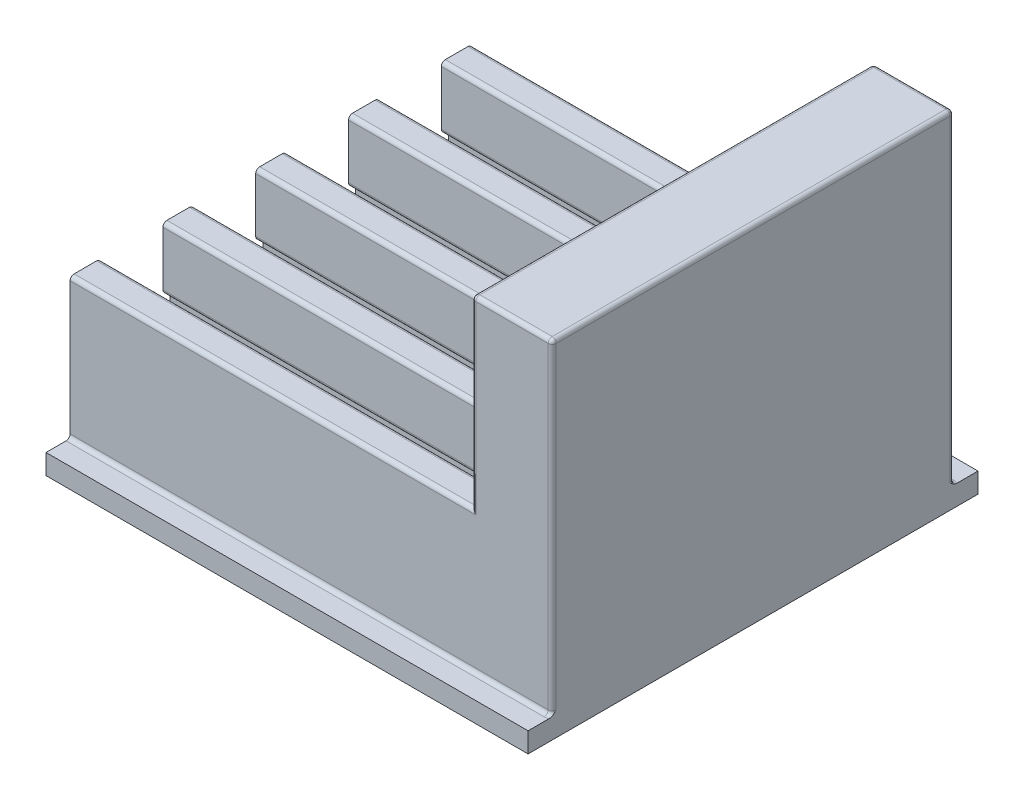
from build123d import *

# Parameters (mm, degrees)
SKETCH1_W           = 120
SKETCH1_H           = 100
BOSS_EXTRUDE1_DEPTH = 81
SKETCH2_W           = 100
SKETCH2_H           = 100
CUT_EXTRUDE1_DEPTH  = 46
SKETCH6_W           = 15.5
SKETCH6_H           = 15.5
CUT_EXTRUDE4_DEPTH  = 100
SKETCH8_W           = 19.1
SKETCH8_H           = 10
CUT_EXTRUDE5_DEPTH  = 100
SKETCH6_3_R         = 5.95
CUT_EXTRUDE6_DEPTH  = 111
FILLET1_R           = 1
CHAMFER1_SIZE       = 1
FILLET2_R           = 1
FILLET3_R           = 1
SKETCH9_W           = 120
SKETCH9_H           = 112
BOSS_EXTRUDE2_DEPTH = 5
FILLET4_R           = 1


with BuildPart() as part:
    # Sketch1 → Boss-Extrude1 (new body)
    with BuildSketch(Plane(origin=(0, 0, 0), x_dir=(1, 0, 0), z_dir=(0, 1, 0))):
        with Locations((-3.53539823, -7.581858407)):
            Rectangle(SKETCH1_W, SKETCH1_H)
    extrude(amount=BOSS_EXTRUDE1_DEPTH)

    # Sketch2 → Cut-Extrude1 (cut)
    with BuildSketch(Plane(origin=(0, 81, 0), x_dir=(1, 0, 0), z_dir=(0, 1, 0))):
        with Locations((-13.53539823, -7.581858407)):
            Rectangle(SKETCH2_W, SKETCH2_H)
    extrude(amount=-CUT_EXTRUDE1_DEPTH, mode=Mode.SUBTRACT)

    # Sketch6 → Cut-Extrude4 (cut)
    with BuildSketch(Plane.ZY.offset(63.53539823)):
        with Locations((-27.068141593, 27.25)):
            Rectangle(SKETCH6_W, SKETCH6_H)
        with Locations((-3.968141593, 27.25)):
            Rectangle(SKETCH6_W, SKETCH6_H)
        with Locations((19.131858407, 27.25)):
            Rectangle(SKETCH6_W, SKETCH6_H)
        with Locations((42.231858407, 27.25)):
            Rectangle(SKETCH6_W, SKETCH6_H)
    extrude(amount=-CUT_EXTRUDE4_DEPTH, mode=Mode.SUBTRACT)

    # Sketch8 → Cut-Extrude5 (cut)
    with BuildSketch(Plane.ZY.offset(63.53539823)):
        with Locations((-27.068141593, 14.5)):
            Rectangle(SKETCH8_W, SKETCH8_H)
        with Locations((-3.968141593, 14.5)):
            Rectangle(SKETCH8_W, SKETCH8_H)
        with Locations((42.231858407, 14.5)):
            Rectangle(SKETCH8_W, SKETCH8_H)
        with Locations((19.131858407, 14.5)):
            Rectangle(SKETCH8_W, SKETCH8_H)
    extrude(amount=-CUT_EXTRUDE5_DEPTH, mode=Mode.SUBTRACT)

    # Sketch6<3> → Cut-Extrude6 (cut)
    with BuildSketch(Plane.ZY.offset(63.53539823)):
        with Locations((-27.068141593, 27.25)):
            Circle(SKETCH6_3_R)
        with Locations((-3.968141593, 27.25)):
            Circle(SKETCH6_3_R)
        with Locations((42.231858407, 27.25)):
            Circle(SKETCH6_3_R)
        with Locations((19.131858407, 27.25)):
            Circle(SKETCH6_3_R)
    extrude(amount=-CUT_EXTRUDE6_DEPTH, mode=Mode.SUBTRACT)

    # Fillet1
    fillet1_edges = [part.edges().sort_by_distance(p)[0] for p in [
        (56.46460177, 81, 7.581858407),
        (46.46460177, 81, 57.581858407),
        (46.46460177, 81, -42.418141593),
        (-13.53539823, 35, -42.418141593),
        (36.46460177, 58, -42.418141593),
        (-13.53539823, 35, 57.581858407),
        (36.46460177, 58, 57.581858407),
        (36.46460177, 81, 7.581858407),
        (56.46460177, 40.5, -42.418141593),
        (56.46460177, 40.5, 57.581858407),
    ]]
    fillet(fillet1_edges, radius=FILLET1_R)

    # Chamfer1
    chamfer1_edges = [part.edges().sort_by_distance(p)[0] for p in [
        (36.46460177, 27.25, -33.018141593),
        (36.46460177, 27.25, -9.918141593),
        (36.46460177, 27.25, 13.181858407),
        (36.46460177, 27.25, 36.281858407),
    ]]
    chamfer(chamfer1_edges, length=CHAMFER1_SIZE)

    # Fillet2
    fillet2_edges = [part.edges().sort_by_distance(p)[0] for p in [
        (47.46460177, 27.25, -33.018141593),
        (47.46460177, 27.25, -9.918141593),
        (47.46460177, 27.25, 13.181858407),
        (47.46460177, 27.25, 36.281858407),
    ]]
    fillet(fillet2_edges, radius=FILLET2_R)

    # Fillet3
    fillet3_edges = [part.edges().sort_by_distance(p)[0] for p in [
        (-13.53539823, 19.5, -19.318141593),
        (-13.53539823, 19.5, -34.818141593),
        (-13.53539823, 35, -34.818141593),
        (-13.53539823, 35, -19.318141593),
        (-13.53539823, 19.5, 3.781858407),
        (-13.53539823, 19.5, -11.718141593),
        (-13.53539823, 35, -11.718141593),
        (-13.53539823, 35, 3.781858407),
        (-13.53539823, 19.5, 49.981858407),
        (-13.53539823, 19.5, 34.481858407),
        (-13.53539823, 35, 34.481858407),
        (-13.53539823, 35, 49.981858407),
        (-13.53539823, 19.5, 26.881858407),
        (-13.53539823, 19.5, 11.381858407),
        (-13.53539823, 35, 11.381858407),
        (-13.53539823, 35, 26.881858407),
    ]]
    fillet(fillet3_edges, radius=FILLET3_R)

    # Sketch9 → Boss-Extrude2 (add)
    with BuildSketch(Plane.XZ):
        with Locations((-3.53539823, 7.581858407)):
            Rectangle(SKETCH9_W, SKETCH9_H)
    extrude(amount=BOSS_EXTRUDE2_DEPTH)

    # Fillet4
    # the kernel refuses this fillet: 1 mm, written as the material it adds along each edge
    with BuildSketch(Plane(origin=(-63.53539823, 0, -42.418141593), x_dir=(0, 0, -1), z_dir=(1, 0, 0)), Plane(origin=(55.46460177, 0, 57.581858407), x_dir=(0, 0, 1), z_dir=(-1, 0, 0))) as fillet4_piece_1:
        with BuildLine():
            CenterArc((FILLET4_R, FILLET4_R), FILLET4_R, 180, 90)
            Line((0, FILLET4_R), (0, 0))
            Line((0, 0), (FILLET4_R, 0))
        make_face()
    extrude(amount=119)
    with BuildSketch(Plane(origin=(55.46460177, 0, -41.418141593), x_dir=(0, 0, -1), z_dir=(-1, 0, 0))) as fillet4_piece_2_section:
        with BuildLine():
            CenterArc((1 + FILLET4_R, -FILLET4_R), FILLET4_R, 90, 90)
            Line((1, -FILLET4_R), (1, 0))
            Line((1, 0), (1 + FILLET4_R, 0))
        make_face()
    fillet4_piece_2 = revolve(axis=Axis((55.46460177, 0, -41.418141593), (0, -1, 0)), revolution_arc=233.296989237, mode=Mode.PRIVATE)
    fillet4_piece_2 = split(fillet4_piece_2, bisect_by=Plane(origin=(56.46460177, 0.167300205, -42.63791684), z_dir=(-1, 0, 0)), keep=Keep.TOP, mode=Mode.PRIVATE)
    add(fillet4_piece_2)
    with BuildSketch(Plane(origin=(55.46460177, 0, 56.581858407), x_dir=(-0.8017442392976468, 0, -0.5976672776328293), z_dir=(-0.5976672776328293, 0, 0.8017442392976468))) as fillet4_piece_3_section:
        with BuildLine():
            CenterArc((1 + FILLET4_R, -FILLET4_R), FILLET4_R, 90, 90)
            Line((1, -FILLET4_R), (1, 0))
            Line((1, 0), (1 + FILLET4_R, 0))
        make_face()
    fillet4_piece_3 = revolve(axis=Axis((55.46460177, 0, 56.581858407), (0, -1, 0)), revolution_arc=233.296989237, mode=Mode.PRIVATE)
    fillet4_piece_3 = split(fillet4_piece_3, bisect_by=Plane(origin=(56.46460177, 0.311628743, 57.33179725), z_dir=(-1, 0, 0)), keep=Keep.TOP, mode=Mode.PRIVATE)
    add(fillet4_piece_3)


solid = part.part
